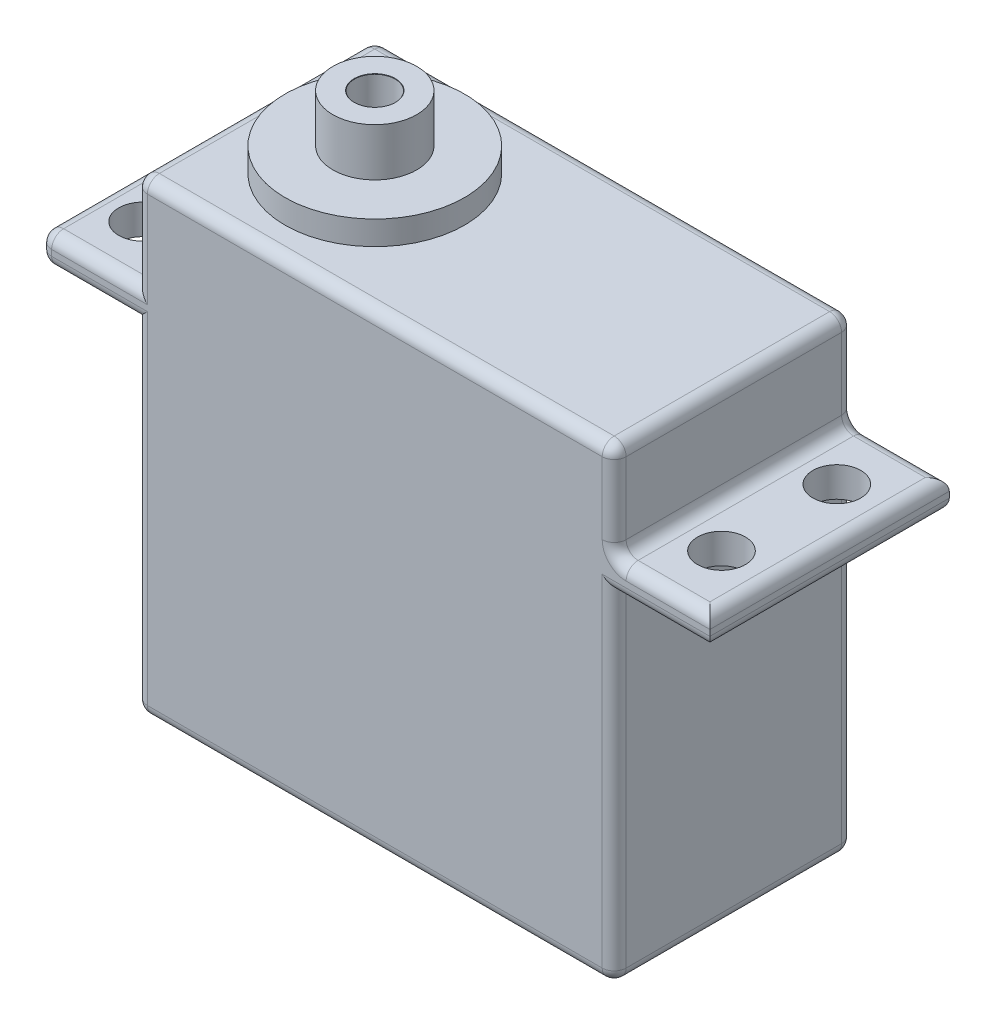
from build123d import *

# Parameters (mm, degrees)
SKETCH_1_W                   = 40
SKETCH_1_H                   = 39
EXTRUDE_1_DEPTH              = 20
SKETCH_2_W                   = 20
SKETCH_2_H                   = 2.5
EXTRUDE_2_DEPTH              = 8
SKETCH_3_W                   = 20
SKETCH_3_H                   = 2.5
EXTRUDE_3_DEPTH              = 8
SKETCH_4_R                   = 2
CUT_EXTRUDE_1_DEPTH          = 2.5
SKETCH_6_R                   = 7.5
EXTRUDE_4_DEPTH              = 2
SKETCH_8_R                   = 3.500115964
EXTRUDE_5_DEPTH              = 6
HOLE_WIZARD_M3_1_D           = 3.4
HOLE_WIZARD_M3_1_DEPTH       = 5
HOLE_WIZARD_M3_1_CSINK_D     = 3.45
HOLE_WIZARD_M3_1_CSINK_ANGLE = 90
HOLE_WIZARD_M3_1_TIP         = 1.021463052
FILLET_4_R                   = 1


with BuildPart() as part:
    # 草图1 → 凸台-拉伸1 (new body)
    with BuildSketch(Plane.XY):
        Rectangle(SKETCH_1_W, SKETCH_1_H)
    extrude(amount=-EXTRUDE_1_DEPTH)

    # 草图2 → 凸台-拉伸2 (add)
    with BuildSketch(Plane(origin=(20, 0, 0), x_dir=(0, 0, -1), z_dir=(1, 0, 0))):
        with Locations((10, 10.25)):
            Rectangle(SKETCH_2_W, SKETCH_2_H)
    extrude(amount=EXTRUDE_2_DEPTH)

    # 草图3 → 凸台-拉伸3 (add)
    with BuildSketch(Plane.ZY.offset(20)):
        with Locations((-10, 10.25)):
            Rectangle(SKETCH_3_W, SKETCH_3_H)
    extrude(amount=EXTRUDE_3_DEPTH)

    # 草图4 → 切除-拉伸1 (cut)
    with BuildSketch(Plane(origin=(0, 11.5, 0), x_dir=(1, 0, 0), z_dir=(0, 1, 0))):
        with Locations((-24.20826531, 14.812514577)):
            Circle(SKETCH_4_R)
        with Locations((-24.20826531, 4.812514577)):
            Circle(SKETCH_4_R)
        with Locations((23.79173469, 14.812514577)):
            Circle(SKETCH_4_R)
        with Locations((23.79173469, 5.176548641)):
            Circle(SKETCH_4_R)
    extrude(amount=-CUT_EXTRUDE_1_DEPTH, mode=Mode.SUBTRACT)

    # 草图6 → 凸台-拉伸4 (add)
    with BuildSketch(Plane(origin=(0, 19.5, 0), x_dir=(1, 0, 0), z_dir=(0, 1, 0))):
        with Locations((-10, 10)):
            Circle(SKETCH_6_R)
    extrude(amount=EXTRUDE_4_DEPTH)

    # 草图8 → 凸台-拉伸5 (add)
    with BuildSketch(Plane(origin=(0, 19.5, 0), x_dir=(1, 0, 0), z_dir=(0, 1, 0))):
        with Locations((-10, 10)):
            Circle(SKETCH_8_R)
    extrude(amount=EXTRUDE_5_DEPTH)

    # M3 间隙孔1
    with Locations(Plane(origin=(0, 25.5, 0), x_dir=(1, 0, 0), z_dir=(0, 1, 0))):
        with Locations((-10, 10)):
            CounterSinkHole(HOLE_WIZARD_M3_1_D / 2, HOLE_WIZARD_M3_1_CSINK_D / 2, depth=HOLE_WIZARD_M3_1_DEPTH, counter_sink_angle=HOLE_WIZARD_M3_1_CSINK_ANGLE)
            with Locations((0, 0, -(HOLE_WIZARD_M3_1_DEPTH + HOLE_WIZARD_M3_1_TIP / 2))):  # 118° drill point
                Cone(0, HOLE_WIZARD_M3_1_D / 2, HOLE_WIZARD_M3_1_TIP, mode=Mode.SUBTRACT)

    # 圆角4
    fillet_4_edges = [part.edges().sort_by_distance(p)[0] for p in [
        (24, 11.5, 0),
        (24, 11.5, -20),
        (20, 15.5, 0),
        (20, 19.5, -10),
        (20, 15.5, -20),
        (20, 11.5, -10),
        (-20, 15.5, -20),
        (28, 11.5, -10),
        (-28, 11.5, -10),
        (-28, 10.25, 0),
        (-28, 10.25, -20),
        (-24, 9, -20),
        (-28, 9, -10),
        (-20, -5.25, -20),
        (-20, -19.5, -10),
        (-20, -5.25, 0),
        (-24, 9, 0),
        (-24, 11.5, 0),
        (-20, 15.5, 0),
        (0, -19.5, -20),
        (0, -19.5, 0),
        (20, -19.5, -10),
        (24, 9, -20),
        (24, 9, 0),
        (28, 9, -10),
        (20, -5.25, -20),
        (20, -5.25, 0),
        (0, 19.5, -20),
        (-20, 19.5, -10),
        (0, 19.5, 0),
    ]]
    fillet(fillet_4_edges, radius=FILLET_4_R)


solid = part.part
